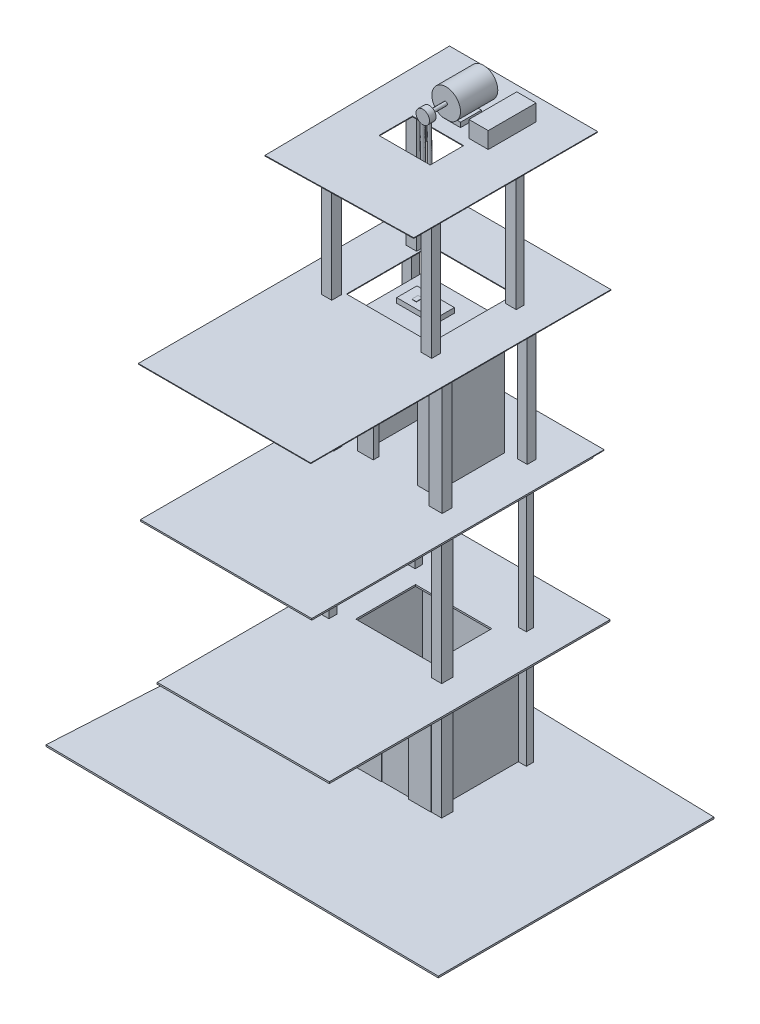
from build123d import *

# Parameters (mm, degrees)
BOSS_EXTRUDE1_DEPTH  = 10
SKETCH2_W            = 622.325209365
SKETCH2_H            = 576.276335175
SKETCH2_W_2          = 550.905616221
SKETCH2_H_2          = 495.653174758
BOSS_EXTRUDE2_DEPTH  = 700
BOSS_EXTRUDE3_DEPTH  = 10
SKETCH4_W            = 343.745663019
SKETCH4_H            = 631.457492732
CUT_EXTRUDE1_DEPTH   = 40
SKETCH5_W            = 96.085656893
SKETCH5_H            = 209.087602639
BOSS_EXTRUDE4_DEPTH  = 1
SKETCH6_W            = 75.527574186
SKETCH6_H            = 43.688329808
CUT_EXTRUDE2_DEPTH   = 1
SKETCH7_R            = 20.29708438
SKETCH7_R_2          = 20.231985555
BOSS_EXTRUDE5_DEPTH  = 1
BOSS_EXTRUDE6_DEPTH  = 1
SKETCH9_W            = 27.290112983
SKETCH9_H            = 631.457492732
BOSS_EXTRUDE7_DEPTH  = 170
SKETCH10_W           = 23.826275683
SKETCH10_H           = 630.503372623
BOSS_EXTRUDE8_DEPTH  = 170
SKETCH11_W           = 102.432085561
SKETCH11_H           = 42.683052162
BOSS_EXTRUDE9_DEPTH  = 1
SKETCH12_W           = 89.43349782
SKETCH12_H           = 33.905937228
CUT_EXTRUDE3_DEPTH   = 1
BOSS_EXTRUDE10_DEPTH = 1
BOSS_EXTRUDE11_DEPTH = 1
BOSS_EXTRUDE12_DEPTH = 1
SKETCH16_W           = 75.527574186
SKETCH16_H           = 43.688329808
CUT_EXTRUDE4_DEPTH   = 2
CUT_EXTRUDE5_DEPTH   = 1
SKETCH18_W           = 75.494640665
SKETCH18_H           = 38.009856791
CUT_EXTRUDE6_DEPTH   = 3
BOSS_EXTRUDE14_DEPTH = 2
BOSS_EXTRUDE15_DEPTH = 2
SKETCH21_W           = 58.041735581
SKETCH21_H           = 45.646263589
SKETCH21_W_2         = 54.653756563
SKETCH21_H_2         = 48.887872675
SKETCH21_W_3         = 63.825775254
SKETCH21_H_3         = 70.153711983
SKETCH21_W_4         = 48.378439297
SKETCH21_H_4         = 43.57114172
BOSS_EXTRUDE16_DEPTH = 1600
SKETCH22_W           = 465.641831392
SKETCH22_H           = 364.631720246
CUT_EXTRUDE7_DEPTH   = 70
SKETCH23_W           = 1044.065648516
SKETCH23_H           = 1716.075641176
BOSS_EXTRUDE18_DEPTH = 5
SKETCH24_W           = 457.620553014
SKETCH24_H           = 438.728357864
SKETCH24_W_2         = 408.58317322
SKETCH24_H_2         = 361.888448332
BOSS_EXTRUDE19_DEPTH = 700
SKETCH25_W           = 269.149998184
SKETCH25_H           = 638.909984856
CUT_EXTRUDE8_DEPTH   = 40
SKETCH26_W           = 59.689733019
SKETCH26_H           = 49.475646729
SKETCH26_W_2         = 79.466053006
SKETCH26_H_2         = 52.312288181
SKETCH26_W_3         = 60.325845498
SKETCH26_H_3         = 54.214911101
SKETCH26_W_4         = 80.955624427
SKETCH26_H_4         = 59.718140062
BOSS_EXTRUDE20_DEPTH = 800
SKETCH28_W           = 519.245743092
SKETCH28_H           = 438.728357864
BOSS_EXTRUDE21_DEPTH = 4
SKETCH29_W           = 228.446922655
SKETCH29_H           = 123.55099219
BOSS_EXTRUDE22_DEPTH = 30
SKETCH30_W           = 1044.065648516
SKETCH30_H           = 1782.700247623
BOSS_EXTRUDE23_DEPTH = 4
SKETCH31_W           = 1050.583005558
SKETCH31_H           = 1830.720434329
BOSS_EXTRUDE24_DEPTH = 4
SKETCH32_W           = 514.990058539
SKETCH32_H           = 511.804992363
CUT_EXTRUDE9_DEPTH   = 4
SKETCH33_W           = 63.367347411
SKETCH33_H           = 56.105555398
SKETCH33_H_2         = 60.314832869
SKETCH33_W_2         = 66.816738156
SKETCH33_H_3         = 52.847434566
SKETCH33_H_4         = 47.907719039
BOSS_EXTRUDE25_DEPTH = 800
SKETCH34_W           = 312.086622111
SKETCH34_H           = 204.425281741
BOSS_EXTRUDE26_DEPTH = 4
SKETCH35_W           = 111.938554272
SKETCH35_H           = 127.879547599
BOSS_EXTRUDE27_DEPTH = 30
SKETCH36_W           = 279.707395095
SKETCH36_H           = 227.391833538
BOSS_EXTRUDE28_DEPTH = 200
CUT_EXTRUDE12_DEPTH  = 300
SKETCH38_W           = 117.692937846
SKETCH38_H           = 291.677988516
BOSS_EXTRUDE30_DEPTH = 100
SKETCH39_R           = 10.828088903
BOSS_EXTRUDE31_DEPTH = 100
SKETCH40_R           = 41.018643384
BOSS_EXTRUDE32_DEPTH = 40
SKETCH41_W           = 27.446128015
SKETCH41_H           = 37.756844249
SKETCH41_W_2         = 24.781836282
BOSS_EXTRUDE33_DEPTH = 2
SKETCH44_R           = 11.467074447
SKETCH46_R           = 9.823580294
SKETCH47_W           = 623.306331777
SKETCH47_H           = 570.678580882
SKETCH47_W_2         = 549.828955375
SKETCH47_H_2         = 462.441804075
BOSS_EXTRUDE34_DEPTH = 300
SKETCH48_W           = 514.95697195
SKETCH48_H           = 266.339325906
CUT_EXTRUDE13_DEPTH  = 60
SKETCH49_W           = 622.859090635
SKETCH49_H           = 570.69260873
BOSS_EXTRUDE35_DEPTH = 30


with BuildPart() as part:
    # Sketch1 → Boss-Extrude1 (new body)
    with BuildSketch(Plane(origin=(0, 0, 0), x_dir=(1, 0, 0), z_dir=(0, 1, 0))):
        Polygon((-1119.518495779, 584.225591226), (1199.119390028, 522.766452142), (1199.119390028, -1157.176571965), (-1218.045061075, -1131.023727215), align=None)
    extrude(amount=BOSS_EXTRUDE1_DEPTH)

    # Sketch2 → Boss-Extrude2 (add)
    with BuildSketch(Plane(origin=(0, 10, 0), x_dir=(1, 0, 0), z_dir=(0, 1, 0))):
        with Locations((0.175057265, -25.815388539)):
            Rectangle(SKETCH2_W, SKETCH2_H)
        with Locations((3.438260109, -29.815460152)):
            Rectangle(SKETCH2_W_2, SKETCH2_H_2, mode=Mode.SUBTRACT)
    extrude(amount=BOSS_EXTRUDE2_DEPTH)

    # Sketch3 → Boss-Extrude3 (add)
    with BuildSketch(Plane(origin=(0, 710, 0), x_dir=(1, 0, 0), z_dir=(0, 1, 0))):
        Polygon((-498.57587171, 538.560257436), (550.684656158, 538.560257436), (550.684656158, -1173.440998756), (-498.57587171, -1173.185548573), align=None)
    extrude(amount=BOSS_EXTRUDE3_DEPTH)

    # Sketch4 → Cut-Extrude1 (cut)
    with BuildSketch(Plane.XY.offset(313.953556126)):
        with Locations((1.971257292, 325.728746366)):
            Rectangle(SKETCH4_W, SKETCH4_H)
    extrude(amount=-CUT_EXTRUDE1_DEPTH, mode=Mode.SUBTRACT)

    # Sketch5 → Boss-Extrude4 (add)
    with BuildSketch(Plane.XY.offset(313.953556126)):
        with Locations((-235.628465158, 369.989290471)):
            Rectangle(SKETCH5_W, SKETCH5_H)
    extrude(amount=BOSS_EXTRUDE4_DEPTH)

    # Sketch6 → Cut-Extrude2 (cut)
    with BuildSketch(Plane.XY.offset(314.953556126)):
        with Locations((-233.410831007, 396.905866965)):
            Rectangle(SKETCH6_W, SKETCH6_H)
    extrude(amount=-CUT_EXTRUDE2_DEPTH, mode=Mode.SUBTRACT)

    # Sketch7 → Boss-Extrude5 (add)
    with BuildSketch(Plane.XY.offset(314.953556126)):
        with Locations((-236.075713016, 343.617219623)):
            Circle(SKETCH7_R)
        with Locations((-236.075713016, 291.501520139)):
            Circle(SKETCH7_R_2)
    extrude(amount=BOSS_EXTRUDE5_DEPTH)

    # Sketch8 → Boss-Extrude6 (add)
    with BuildSketch(Plane.XY.offset(315.953556126)):
        Polygon((-248.100542069, 334.343180385), (-224.116847865, 334.343180385), (-236.108694967, 356.570085863), align=None)
        Polygon((-248.100542069, 300.734143469), (-224.116847865, 300.734143469), (-236.108694967, 278.021129489), align=None)
    extrude(amount=BOSS_EXTRUDE6_DEPTH)

    # Sketch9 → Boss-Extrude7 (add)
    with BuildSketch(Plane(origin=(-169.901574217, 0, 0), x_dir=(0, 0, -1), z_dir=(1, 0, 0))):
        with Locations((-291.287104022, 325.728746366)):
            Rectangle(SKETCH9_W, SKETCH9_H)
    extrude(amount=BOSS_EXTRUDE7_DEPTH)

    # Sketch10 → Boss-Extrude8 (add)
    with BuildSketch(Plane(origin=(0.098425783, 0, 0), x_dir=(0, 0, -1), z_dir=(1, 0, 0))):
        with Locations((-289.555185372, 325.251686312)):
            Rectangle(SKETCH10_W, SKETCH10_H)
    extrude(amount=BOSS_EXTRUDE8_DEPTH)

    # Sketch11 → Boss-Extrude9 (add)
    with BuildSketch(Plane.XY.offset(313.953556126)):
        with Locations((-2.491684156, 672.586316149)):
            Rectangle(SKETCH11_W, SKETCH11_H)
    extrude(amount=BOSS_EXTRUDE9_DEPTH)

    # Sketch12 → Cut-Extrude3 (cut)
    with BuildSketch(Plane.XY.offset(314.953556126)):
        with Locations((-2.82995258, 672.168915251)):
            Rectangle(SKETCH12_W, SKETCH12_H)
    extrude(amount=-CUT_EXTRUDE3_DEPTH, mode=Mode.SUBTRACT)

    # Sketch13 → Boss-Extrude10 (add)
    with BuildSketch(Plane.XY.offset(313.953556126)):
        Polygon((-16.188659158, 682.333537789), (-12.363636267, 682.333537789), (-16.280886962, 666.180161515), (-10.826136902, 666.180161515), (-10.826136902, 671.523280071), (-7.909927509, 671.523280071), (-7.909927509, 666.180161515), (-5.371386842, 666.180161515), (-5.371386842, 662.797245592), (-7.909927509, 662.797245592), (-7.909927509, 659.936990738), (-10.826136902, 659.936990738), (-10.826136902, 662.797245592), (-21.28940391, 662.797245592), align=None)
    extrude(amount=BOSS_EXTRUDE10_DEPTH)

    # Sketch14 → Boss-Extrude11 (add)
    with BuildSketch(Plane.XY.offset(313.953556126)):
        Polygon((8.28251296, 678.526064939), (25.453577984, 678.526064939), (16.868045472, 660.40217423), align=None)
    extrude(amount=BOSS_EXTRUDE11_DEPTH)

    # Sketch15 → Boss-Extrude12 (add)
    with BuildSketch(Plane.XY.offset(313.953556126)):
        Polygon((-253.392365097, 406.408287302), (-253.392365097, 387.565087067), (-258.932297981, 387.565087067), (-258.932297981, 385.030446751), (-244.376138332, 385.030446751), (-244.376138332, 387.568096861), (-249.880180429, 387.568096861), (-249.880180429, 410.563051887), (-259.692933011, 410.252172121), (-259.566620724, 406.408287302), align=None)
    extrude(amount=BOSS_EXTRUDE12_DEPTH)

    # Sketch16 → Cut-Extrude4 (cut)
    with BuildSketch(Plane.XY.offset(313.953556126)):
        with Locations((-233.410831007, 396.905866965)):
            Rectangle(SKETCH16_W, SKETCH16_H)
        Polygon((-258.932297981, 387.565087067), (-253.392365097, 387.565087067), (-253.392365097, 406.408287302), (-259.566620724, 406.408287302), (-259.692933011, 410.252172121), (-249.880180429, 410.563051887), (-249.880180429, 387.568096861), (-244.376138332, 387.568096861), (-244.376138332, 385.030446751), (-258.932297981, 385.030446751), align=None, mode=Mode.SUBTRACT)
        with BuildLine():
            Line((-235.648545177, 385.585769087), (-235.648545177, 408.465773981))
            Line((-235.648545177, 408.465773981), (-231.895053527, 408.465773981))
            Line((-231.895053527, 408.465773981), (-231.895053527, 406.607783771))
            ThreePointArc((-231.895053527, 406.607783771), (-226.013052079, 408.340663022), (-220.604725505, 405.450885314))
            ThreePointArc((-220.604725505, 405.450885314), (-212.450287881, 408.121471894), (-206.512581436, 401.927077024))
            Line((-206.512581436, 401.927077024), (-206.270978925, 385.585769087))
            Line((-206.270978925, 385.585769087), (-208.886279481, 385.585769087))
            Line((-208.886279481, 385.585769087), (-208.886279481, 401.591739947))
            ThreePointArc((-208.886279481, 401.591739947), (-213.544522639, 405.905815865), (-219.282803566, 403.188719557))
            Line((-219.282803566, 403.188719557), (-219.086260967, 397.970062451))
            Line((-219.086260967, 397.970062451), (-218.821188952, 385.585769087))
            Line((-218.821188952, 385.585769087), (-221.983422689, 385.585769087))
            Line((-221.983422689, 385.585769087), (-221.983422689, 403.056833873))
            ThreePointArc((-221.983422689, 403.056833873), (-227.433038153, 405.693579889), (-232.223072214, 401.991376226))
            Line((-232.223072214, 401.991376226), (-232.106265572, 385.585769087))
            Line((-232.106265572, 385.585769087), (-235.648545177, 385.585769087))
        make_face(mode=Mode.SUBTRACT)
    extrude(amount=-CUT_EXTRUDE4_DEPTH, mode=Mode.SUBTRACT)

    # Sketch17 → Cut-Extrude5 (cut)
    with BuildSketch(Plane.XY.offset(311.953556126)):
        Polygon((-271.209439503, 458.857228745), (-195.647043914, 458.857228745), (-195.704078741, 418.44137546), (-271.209439503, 418.44137546), align=None)
    extrude(amount=-CUT_EXTRUDE5_DEPTH, mode=Mode.SUBTRACT)

    # Sketch18 → Cut-Extrude6 (cut)
    with BuildSketch(Plane.XY.offset(314.953556126)):
        with Locations((-233.394364247, 437.754960265)):
            Rectangle(SKETCH18_W, SKETCH18_H)
    extrude(amount=-CUT_EXTRUDE6_DEPTH, mode=Mode.SUBTRACT)

    # Sketch19 → Boss-Extrude14 (add)
    with BuildSketch(Plane.XY.offset(310.953556126)):
        Polygon((-254.312852224, 446.740647117), (-254.312852224, 426.35566573), (-259.396180858, 426.35566573), (-259.396180858, 423.275008449), (-244.678284124, 423.275008449), (-244.678284124, 426.345347073), (-250.728067912, 426.345347073), (-250.728067912, 450.11543046), (-259.396180858, 450.11543046), (-259.396180858, 446.740647117), align=None)
    extrude(amount=BOSS_EXTRUDE14_DEPTH)

    # Sketch20 → Boss-Extrude15 (add)
    with BuildSketch(Plane.XY.offset(310.953556126)):
        with BuildLine():
            Line((-231.738910846, 449.836701393), (-231.738910846, 423.361516406))
            Line((-231.738910846, 423.361516406), (-228.297984767, 423.361516406))
            Line((-228.297984767, 423.361516406), (-228.145561752, 436.327846212))
            ThreePointArc((-228.145561752, 436.327846212), (-216.928259639, 443.252630869), (-228.56606882, 449.444715067))
            Line((-228.56606882, 449.444715067), (-228.61564163, 450.293665645))
            Line((-228.61564163, 450.293665645), (-231.738910846, 450.293665645))
            Line((-231.738910846, 450.293665645), (-231.738910846, 449.836701393))
        make_face()
        with BuildLine():
            Line((-228.56606882, 446.492870427), (-228.297984767, 439.236609845))
            ThreePointArc((-228.297984767, 439.236609845), (-219.191503534, 443.206133185), (-228.56606882, 446.492870427))
        make_face(mode=Mode.SUBTRACT)
    extrude(amount=BOSS_EXTRUDE15_DEPTH)

    # Sketch21 → Boss-Extrude16 (add)
    with BuildSketch(Plane(origin=(0, 10, 0), x_dir=(1, 0, 0), z_dir=(0, 1, 0))):
        with Locations((-341.228646018, 235.659694827)):
            Rectangle(SKETCH21_W, SKETCH21_H)
        with Locations((-338.314425699, -289.509619789)):
            Rectangle(SKETCH21_W_2, SKETCH21_H_2)
        with Locations((343.449473115, -277.469052902)):
            Rectangle(SKETCH21_W_3, SKETCH21_H_3)
        with Locations((335.526881597, 240.537208189)):
            Rectangle(SKETCH21_W_4, SKETCH21_H_4)
    extrude(amount=BOSS_EXTRUDE16_DEPTH)

    # Sketch22 → Cut-Extrude7 (cut)
    with BuildSketch(Plane(origin=(0, 720, 0), x_dir=(1, 0, 0), z_dir=(0, 1, 0))):
        with Locations((5.017295511, -51.54680296)):
            Rectangle(SKETCH22_W, SKETCH22_H)
    extrude(amount=-CUT_EXTRUDE7_DEPTH, mode=Mode.SUBTRACT)

    # Sketch23 → Boss-Extrude18 (add)
    with BuildSketch(Plane(origin=(0, 1610, 0), x_dir=(1, 0, 0), z_dir=(0, 1, 0))):
        with Locations((12.155944641, -405.855425018)):
            Rectangle(SKETCH23_W, SKETCH23_H)
    extrude(amount=BOSS_EXTRUDE18_DEPTH)

    # Sketch24 → Boss-Extrude19 (add)
    with BuildSketch(Plane(origin=(0, 1615, 0), x_dir=(1, 0, 0), z_dir=(0, 1, 0))):
        with Locations((18.417503891, -19.91757462)):
            Rectangle(SKETCH24_W, SKETCH24_H)
        with Locations((13.85417238, -22.964240496)):
            Rectangle(SKETCH24_W_2, SKETCH24_H_2, mode=Mode.SUBTRACT)
    extrude(amount=BOSS_EXTRUDE19_DEPTH)

    # Sketch25 → Cut-Extrude8 (cut)
    with BuildSketch(Plane.XY.offset(239.281753552)):
        with Locations((19.28021046, 1934.454992428)):
            Rectangle(SKETCH25_W, SKETCH25_H)
    extrude(amount=-CUT_EXTRUDE8_DEPTH, mode=Mode.SUBTRACT)

    # Sketch26 → Boss-Extrude20 (add)
    with BuildSketch(Plane(origin=(0, 1615, 0), x_dir=(1, 0, 0), z_dir=(0, 1, 0))):
        with Locations((-362.18795287, 236.087098167)):
            Rectangle(SKETCH26_W, SKETCH26_H)
        with Locations((-322.454926366, -288.258242075)):
            Rectangle(SKETCH26_W_2, SKETCH26_H_2)
        with Locations((347.582849239, 233.422104066)):
            Rectangle(SKETCH26_W_3, SKETCH26_H_3)
        with Locations((337.267959775, -282.185245591)):
            Rectangle(SKETCH26_W_4, SKETCH26_H_4)
    extrude(amount=BOSS_EXTRUDE20_DEPTH)

    # Sketch28 → Boss-Extrude21 (add)
    with BuildSketch(Plane(origin=(0, 2315, 0), x_dir=(1, 0, 0), z_dir=(0, 1, 0))):
        with Locations((6.532700236, -19.91757462)):
            Rectangle(SKETCH28_W, SKETCH28_H)
    extrude(amount=BOSS_EXTRUDE21_DEPTH)

    # Sketch29 → Boss-Extrude22 (add)
    with BuildSketch(Plane(origin=(0, 2319, 0), x_dir=(1, 0, 0), z_dir=(0, 1, 0))):
        with Locations((-57.096223776, 21.119776465)):
            Rectangle(SKETCH29_W, SKETCH29_H)
    extrude(amount=BOSS_EXTRUDE22_DEPTH)

    # Sketch30 → Boss-Extrude23 (add)
    with BuildSketch(Plane(origin=(0, 1615, 0), x_dir=(1, 0, 0), z_dir=(0, 1, 0))):
        with Locations((12.155944641, -372.543121795)):
            Rectangle(SKETCH30_W, SKETCH30_H)
    extrude(amount=BOSS_EXTRUDE23_DEPTH)

    # Sketch31 → Boss-Extrude24 (add)
    with BuildSketch(Plane(origin=(0, 2415, 0), x_dir=(1, 0, 0), z_dir=(0, 1, 0))):
        with Locations((-15.788561063, -330.533035321)):
            Rectangle(SKETCH31_W, SKETCH31_H)
    extrude(amount=BOSS_EXTRUDE24_DEPTH)

    # Sketch32 → Cut-Extrude9 (cut)
    with BuildSketch(Plane(origin=(0, 2419, 0), x_dir=(1, 0, 0), z_dir=(0, 1, 0))):
        with Locations((-15.781275819, 11.28944274)):
            Rectangle(SKETCH32_W, SKETCH32_H)
    extrude(amount=-CUT_EXTRUDE9_DEPTH, mode=Mode.SUBTRACT)

    # Sketch33 → Boss-Extrude25 (add)
    with BuildSketch(Plane(origin=(0, 2419, 0), x_dir=(1, 0, 0), z_dir=(0, 1, 0))):
        with Locations((-316.709024345, 222.68762458)):
            Rectangle(SKETCH33_W, SKETCH33_H)
        with Locations((-316.709024345, -292.724283335)):
            Rectangle(SKETCH33_W, SKETCH33_H_2)
        with Locations((293.409416414, -298.493544952)):
            Rectangle(SKETCH33_W_2, SKETCH33_H_3)
        with Locations((293.409416414, 214.129268769)):
            Rectangle(SKETCH33_W_2, SKETCH33_H_4)
    extrude(amount=BOSS_EXTRUDE25_DEPTH)

    # Sketch34 → Boss-Extrude26 (add)
    with BuildSketch(Plane(origin=(0, 3219, 0), x_dir=(1, 0, 0), z_dir=(0, 1, 0))):
        Polygon((438.893469042, 574.738573391), (-464.628874936, 574.738573391), (-449.624556892, -565.264865707), (438.893469042, -546.439599472), align=None)
        with Locations((-51.429821055, -10.284957)):
            Rectangle(SKETCH34_W, SKETCH34_H, mode=Mode.SUBTRACT)
    extrude(amount=BOSS_EXTRUDE26_DEPTH)

    # Sketch35 → Boss-Extrude27 (add)
    with BuildSketch(Plane(origin=(0, 3223, 0), x_dir=(1, 0, 0), z_dir=(0, 1, 0))):
        with Locations((-55.969277136, 240.974060897)):
            Rectangle(SKETCH35_W, SKETCH35_H)
    extrude(amount=BOSS_EXTRUDE27_DEPTH)

    # Sketch36 → Boss-Extrude28 (add)
    with BuildSketch(Plane(origin=(0, 3253, 0), x_dir=(1, 0, 0), z_dir=(0, 1, 0))):
        with Locations((-58.018918374, 261.951392482)):
            Rectangle(SKETCH36_W, SKETCH36_H)
    extrude(amount=BOSS_EXTRUDE28_DEPTH)

    # Sketch37 → Cut-Extrude12 (cut)
    with BuildSketch(Plane.XY.offset(-148.255475713)):
        with BuildLine():
            Line((-36.513660596, 3251.837379956), (81.834779174, 3251.491552197))
            Line((81.834779174, 3251.491552197), (81.834779174, 3453))
            Line((81.834779174, 3453), (-197.872615921, 3453))
            Line((-197.872615921, 3453), (-197.872615921, 3252.308889391))
            Line((-197.872615921, 3252.308889391), (-80.943925959, 3251.967210304))
            ThreePointArc((-80.943925959, 3251.967210304), (-58.226698877, 3423.727972341), (-36.513660596, 3251.837379956))
        make_face()
    extrude(amount=-CUT_EXTRUDE12_DEPTH, mode=Mode.SUBTRACT)

    # Sketch38 → Boss-Extrude30 (add)
    with BuildSketch(Plane(origin=(0, 3223, 0), x_dir=(1, 0, 0), z_dir=(0, 1, 0))):
        with Locations((141.222924039, 291.965818935)):
            Rectangle(SKETCH38_W, SKETCH38_H)
    extrude(amount=BOSS_EXTRUDE30_DEPTH)

    # Sketch39 → Boss-Extrude31 (add)
    with BuildSketch(Plane.XY.offset(-148.255475713)):
        with Locations((-61.625784042, 3334.571892159)):
            Circle(SKETCH39_R)
    extrude(amount=BOSS_EXTRUDE31_DEPTH)

    # Sketch40 → Boss-Extrude32 (add)
    with BuildSketch(Plane.XY.offset(-48.255475713)):
        with Locations((-61.237530516, 3333.515347994)):
            Circle(SKETCH40_R)
    extrude(amount=BOSS_EXTRUDE32_DEPTH)

    # Sketch41 → Boss-Extrude33 (add)
    with BuildSketch(Plane(origin=(0, 2349, 0), x_dir=(1, 0, 0), z_dir=(0, 1, 0))):
        with Locations((-101.792050733, 14.948680038)):
            Rectangle(SKETCH41_W, SKETCH41_H)
        with Locations((9.217155089, 14.948680038)):
            Rectangle(SKETCH41_W_2, SKETCH41_H)
    extrude(amount=BOSS_EXTRUDE33_DEPTH)

    # Sweep2: sweep along a curve in space
    with BuildLine() as sweep2_path:
        Line((-69.818676956, 2349, -25.14068985), (-79.185210588, 3344.674561059, -25.14068985))
    # Sketch44 → Sweep2 (sweep)
    with BuildSketch(Plane(origin=(0, 2349, 0), x_dir=(1, 0, 0), z_dir=(0, 1, 0))):
        with Locations((-69.818676956, 25.14068985)):
            Circle(SKETCH44_R)
    sweep(path=sweep2_path.line)

    # Sweep3: sweep along a curve in space
    with BuildLine() as sweep3_path:
        Line((-25.06985845, 2349, -26.133194889), (-39.649239442, 3323.467405095, -26.133194889))
    # Sketch46 → Sweep3 (sweep)
    with BuildSketch(Plane(origin=(0, 2349, 0), x_dir=(1, 0, 0), z_dir=(0, 1, 0))):
        with Locations((-25.06985845, 26.133194889)):
            Circle(SKETCH46_R)
    sweep(path=sweep3_path.line)

    # Sketch47 → Boss-Extrude34 (add)
    with BuildSketch(Plane(origin=(0, 0, 0), x_dir=(-1, 0, 0), z_dir=(0, -1, 0))):
        with Locations((-3.809117878, -114.011349818)):
            Rectangle(SKETCH47_W, SKETCH47_H)
        with Locations((9.185733485, -117.983065203)):
            Rectangle(SKETCH47_W_2, SKETCH47_H_2, mode=Mode.SUBTRACT)
    extrude(amount=BOSS_EXTRUDE34_DEPTH)

    # Sketch48 → Cut-Extrude13 (cut)
    with BuildSketch(Plane.XY.offset(399.350640259)):
        with Locations((4.540089723, -166.830337047)):
            Rectangle(SKETCH48_W, SKETCH48_H)
    extrude(amount=-CUT_EXTRUDE13_DEPTH, mode=Mode.SUBTRACT)

    # Sketch49 → Boss-Extrude35 (add)
    with BuildSketch(Plane(origin=(0, -300, 0), x_dir=(-1, 0, 0), z_dir=(0, -1, 0))):
        with Locations((-4.032738448, -114.018363742)):
            Rectangle(SKETCH49_W, SKETCH49_H)
    extrude(amount=BOSS_EXTRUDE35_DEPTH)


solid = part.part
